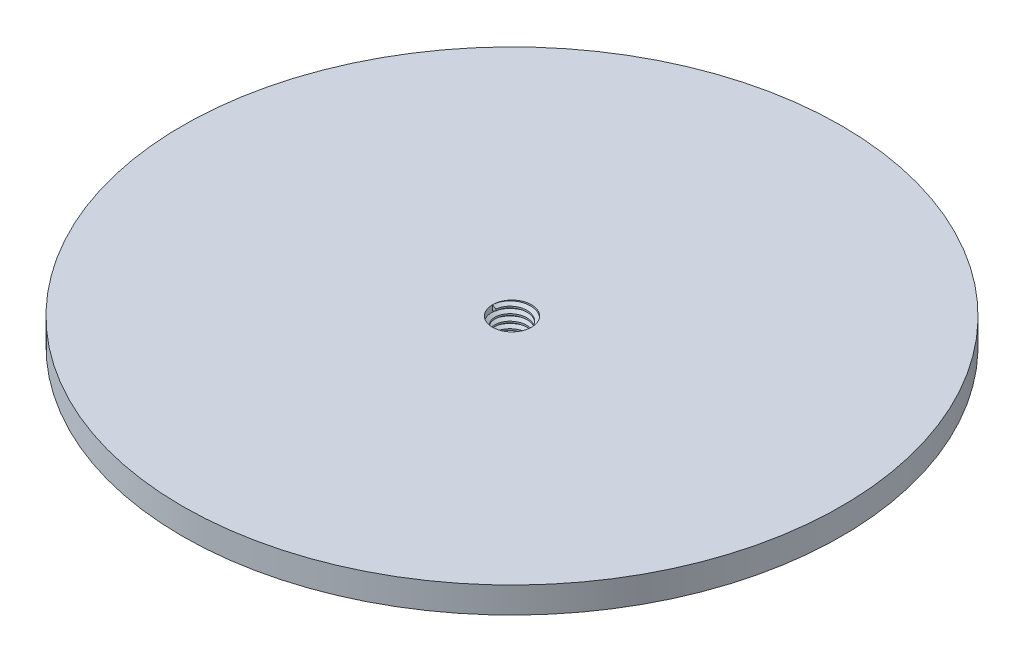
from build123d import *
from build123d.topology import SkipClean

# Parameters (mm, degrees)
SKETCH1_R           = 80.391
BOSS_EXTRUDE1_DEPTH = 6.35
SKETCH3_R           = 4.7625
CUT_EXTRUDE2_DEPTH  = 114.867239635
THREAD1_PITCH       = 1.5875


with BuildPart() as part:
    # Sketch1 → Boss-Extrude1 (new body)
    with BuildSketch(Plane(origin=(0, 0, 0), x_dir=(1, 0, 0), z_dir=(0, 1, 0))):
        with Locations(Location((0, 0, 0), (0, 0, 270))):
            Circle(SKETCH1_R)
    extrude(amount=BOSS_EXTRUDE1_DEPTH)

    # Sketch3 → Cut-Extrude2 (cut, through all)
    with BuildSketch(Plane(origin=(0, 6.35, 0), x_dir=(1, 0, 0), z_dir=(0, 1, 0))):
        with Locations(Location((0, 0, 0), (0, 0, 270))):
            Circle(SKETCH3_R)
    extrude(amount=-CUT_EXTRUDE2_DEPTH, mode=Mode.SUBTRACT)

    # Thread1: the profile of Thread Profile1 profile screwed along a right-hand helix of 4 turns, 8 arcs to a turn; built about Z, then put on its axis
    with SkipClean():  # the faces are left unmerged after this step: merging them gives an invalid solid
        thread1_z = Axis((0, 0, 0), (0, 0, 1))
        thread1_corners = [(4.7628, 0, -0.000173205), (4.7628, 0, 1.389235701), (3.903240423, 0, 0.892968748), (3.903240423, 0, 0.496093748)]
        with BuildLine(mode=Mode.PRIVATE) as thread1_profile:
            Line(thread1_corners[0], thread1_corners[1])
            Line(thread1_corners[1], thread1_corners[2])
            Line(thread1_corners[2], thread1_corners[3])
            Line(thread1_corners[3], thread1_corners[0])
        thread1_cap = Face(thread1_profile.wire())
        thread1_turn_angles = [0, 22.5, 45, 67.5, 90, 112.5, 135, 157.5, 180, 202.5, 225, 247.5, 270, 292.5, 315, 337.5, 360]
        thread1_turn_weights = [1, 0.9238795325112867, 1, 0.9238795325112867, 1, 0.9238795325112867, 1, 0.9238795325112867, 1, 0.9238795325112867, 1, 0.9238795325112867, 1, 0.9238795325112867, 1, 0.9238795325112867, 1]
        thread1_turn_rails = [Edge.make_bspline([Vector(p[0], p[1], 0).rotate(thread1_z, thread1_turn_angles[k]) / thread1_turn_weights[k] + Vector(0, 0, p[2] + THREAD1_PITCH * thread1_turn_angles[k] / 360) for k in range(17)], [0, 0, 0, 1, 1, 2, 2, 3, 3, 4, 4, 5, 5, 6, 6, 7, 7, 8, 8, 8], 2, thread1_turn_weights) for p in thread1_corners]
        thread1_turn_sides = [Face.make_surface_from_curves(thread1_turn_rails[p[0]], thread1_turn_rails[p[1]]) for p in [(0, 1), (1, 2), (2, 3), (3, 0)]]
        thread1 = Plane(origin=(0, 6.35, 0), x_dir=(-1, 0, 0), z_dir=(0, -1, 0)) * Solid(Shell([*[p.moved(Location((0, 0, THREAD1_PITCH * i))) for i in range(4) for p in thread1_turn_sides], thread1_cap, thread1_cap.rotate(thread1_z, 1440).moved(Location((0, 0, THREAD1_PITCH * 1440 / 360)))]))
        add(thread1)


solid = part.part
